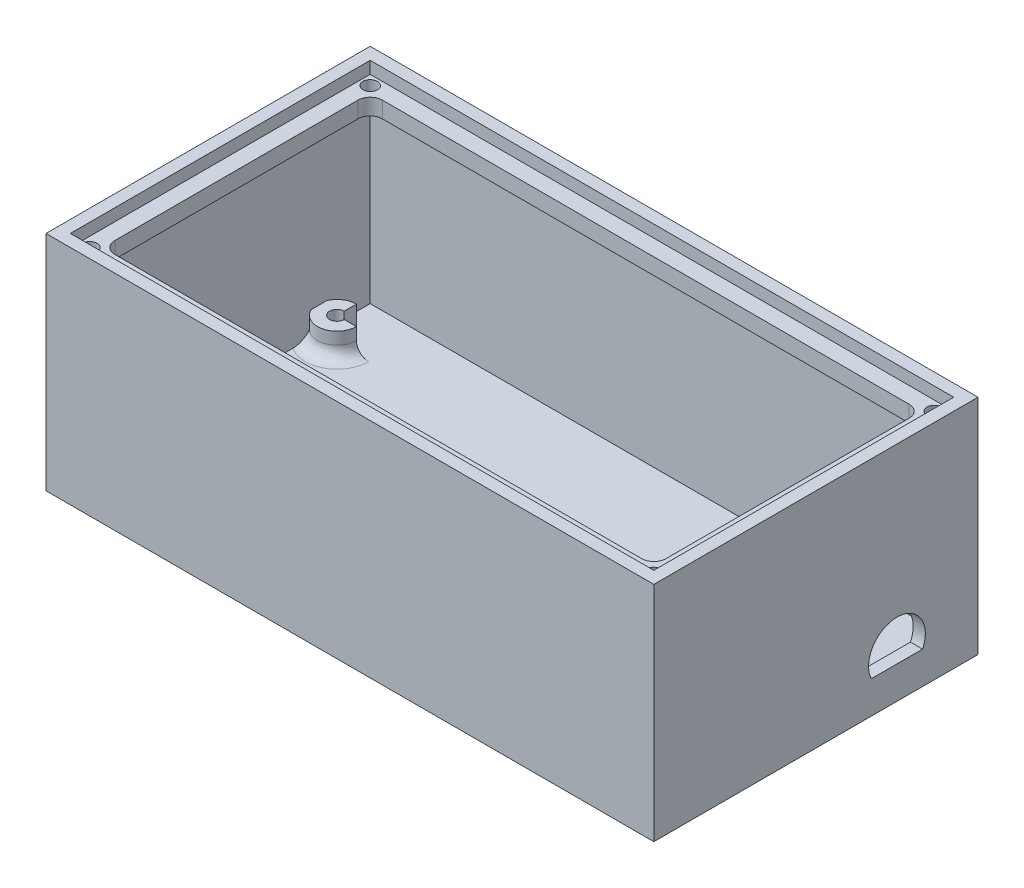
from build123d import *

# Parameters (mm, degrees)
SKETCH1_W           = 75
SKETCH1_H           = 40
BOSS_EXTRUDE1_DEPTH = 1.5
SKETCH2_W           = 75
SKETCH2_H           = 40
SKETCH2_W_2         = 72
SKETCH2_H_2         = 37
BOSS_EXTRUDE2_DEPTH = 26
SKETCH3_W           = 9
SKETCH3_H           = 3.5
CUT_EXTRUDE1_DEPTH  = 25
FILLET1_R           = 1
BOSS_EXTRUDE3_DEPTH = 3
FILLET2_R           = 1.5
CUT_EXTRUDE2_DEPTH  = 3
BOSS_EXTRUDE4_START = -3.5
SKETCH6_W           = 75
SKETCH6_H           = 40
SKETCH6_W_2         = 68
SKETCH6_H_2         = 33
BOSS_EXTRUDE4_DEPTH = 2
FILLET3_R           = 1.5
SKETCH9_R           = 0.9
CUT_EXTRUDE3_DEPTH  = 4


with BuildPart() as part:
    # Sketch1 → Boss-Extrude1 (new body)
    with BuildSketch(Plane(origin=(0, 0, 0), x_dir=(1, 0, 0), z_dir=(0, 1, 0))):
        with Locations((37.5, 20)):
            Rectangle(SKETCH1_W, SKETCH1_H)
    extrude(amount=BOSS_EXTRUDE1_DEPTH)

    # Sketch2 → Boss-Extrude2 (add)
    with BuildSketch(Plane(origin=(0, 1.5, 0), x_dir=(1, 0, 0), z_dir=(0, 1, 0))):
        with Locations((37.5, 20)):
            Rectangle(SKETCH2_W, SKETCH2_H)
        with Locations((37.5, 20)):
            Rectangle(SKETCH2_W_2, SKETCH2_H_2, mode=Mode.SUBTRACT)
    extrude(amount=BOSS_EXTRUDE2_DEPTH)

    # Sketch3 → Cut-Extrude1 (cut)
    with BuildSketch(Plane.ZY):
        with Locations((-20, 3.25)):
            Rectangle(SKETCH3_W, SKETCH3_H)
    extrude(amount=-CUT_EXTRUDE1_DEPTH, mode=Mode.SUBTRACT)

    # Fillet1
    fillet1_edges = [part.edges().sort_by_distance(p)[0] for p in [
        (0.75, 5, -24.5),
        (0.75, 5, -15.5),
    ]]
    fillet(fillet1_edges, radius=FILLET1_R)

    # Sketch4 → Boss-Extrude3 (add)
    with BuildSketch(Plane(origin=(0, 1.5, 0), x_dir=(1, 0, 0), z_dir=(0, 1, 0))):
        with BuildLine():
            Line((4.6, 32.2), (6.1, 32.2))
            ThreePointArc((6.1, 32.2), (2.002943725, 30.502943725), (3.7, 34.6))
            Line((3.7, 34.6), (3.7, 33.1))
            ThreePointArc((3.7, 33.1), (3.063603897, 31.563603897), (4.6, 32.2))
        make_face()
        with BuildLine():
            Line((54.6, 33.1), (54.6, 34.6))
            ThreePointArc((54.6, 34.6), (56.297056275, 30.502943725), (52.2, 32.2))
            Line((52.2, 32.2), (53.7, 32.2))
            ThreePointArc((53.7, 32.2), (55.236396103, 31.563603897), (54.6, 33.1))
        make_face()
        with BuildLine():
            Line((3.7, 6.9), (3.7, 5.4))
            ThreePointArc((3.7, 5.4), (2.002943725, 9.497056275), (6.1, 7.8))
            Line((6.1, 7.8), (4.6, 7.8))
            ThreePointArc((4.6, 7.8), (3.063603897, 8.436396103), (3.7, 6.9))
        make_face()
        with BuildLine():
            Line((54.6, 6.9), (54.6, 5.4))
            ThreePointArc((54.6, 5.4), (56.297056275, 9.497056275), (52.2, 7.8))
            Line((52.2, 7.8), (53.7, 7.8))
            ThreePointArc((53.7, 7.8), (55.236396103, 8.436396103), (54.6, 6.9))
        make_face()
    extrude(amount=BOSS_EXTRUDE3_DEPTH)

    # Fillet2
    fillet2_edges = [part.edges().sort_by_distance(p)[0] for p in [
        (56.297056275, 1.5, -9.497056275),
        (56.297056275, 1.5, -30.502943725),
        (4.189897949, 1.5, -10.149468025),
        (4.189897949, 1.5, -29.850531975),
    ]]
    fillet(fillet2_edges, radius=FILLET2_R)

    # Sketch5 → Cut-Extrude2 (cut)
    with BuildSketch(Plane(origin=(75, 0, 0), x_dir=(0, 0, -1), z_dir=(1, 0, 0))):
        with BuildLine():
            Line((26.83772234, 4), (33.16227766, 4))
            ThreePointArc((33.16227766, 4), (30, 9), (26.83772234, 4))
        make_face()
    extrude(amount=-CUT_EXTRUDE2_DEPTH, mode=Mode.SUBTRACT)

    # Sketch6 → Boss-Extrude4 (add)
    with BuildSketch(Plane(origin=(0, 27.5, 0), x_dir=(1, 0, 0), z_dir=(0, 1, 0)).offset(BOSS_EXTRUDE4_START)):
        with Locations((37.5, 20)):
            Rectangle(SKETCH6_W, SKETCH6_H)
        with Locations((37.5, 20)):
            Rectangle(SKETCH6_W_2, SKETCH6_H_2, mode=Mode.SUBTRACT)
    extrude(amount=BOSS_EXTRUDE4_DEPTH)

    # Fillet3
    fillet3_edges = [part.edges().sort_by_distance(p)[0] for p in [
        (1.5, 24, -20),
        (37.5, 24, -1.5),
        (73.5, 24, -20),
        (37.5, 24, -38.5),
        (71.5, 25, -3.5),
        (71.5, 25, -36.5),
        (3.5, 25, -3.5),
        (3.5, 25, -36.5),
    ]]
    fillet(fillet3_edges, radius=FILLET3_R)

    # Sketch9 → Cut-Extrude3 (cut)
    with BuildSketch(Plane(origin=(0, 26, 0), x_dir=(1, 0, 0), z_dir=(0, 1, 0))):
        with Locations((2.7, 37.3)):
            Circle(SKETCH9_R)
        with Locations((2.7, 2.7)):
            Circle(SKETCH9_R)
        with Locations((72.3, 2.7)):
            Circle(SKETCH9_R)
        with Locations((72.3, 37.3)):
            Circle(SKETCH9_R)
    extrude(amount=-CUT_EXTRUDE3_DEPTH, mode=Mode.SUBTRACT)


solid = part.part
